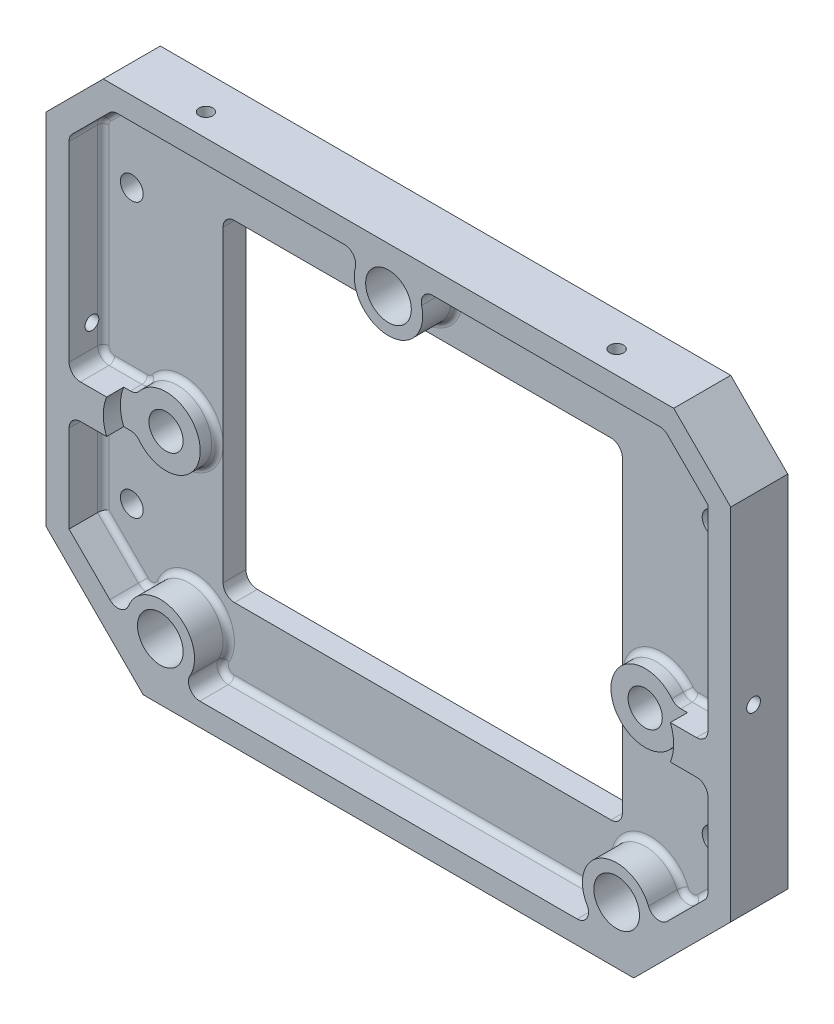
from build123d import *

# Parameters (mm, degrees)
SKETCH_1_R                = 2
SKETCH_1_R_2              = 1.5
EXTRUDE_1_DEPTH           = 2
BOSS_EXTRUDE1_OUTLINE_R   = 2
BOSS_EXTRUDE1_OUTLINE_R_2 = 1.5
BOSS_EXTRUDE1_DEPTH       = 3
FILLET2_R                 = 1
FILLET3_R                 = 0.5
SKETCH4_R                 = 4
CUT_EXTRUDE3_DEPTH        = 1.5
SKETCH5_R                 = 0.6
CUT_EXTRUDE4_DEPTH        = 2.5
SKETCH3_R                 = 1
CUT_EXTRUDE5_DEPTH        = 10
SKETCH6_R                 = 0.6
CUT_EXTRUDE6_DEPTH        = 65


# Read off the part's stored shape, not the designer's step: Boss-Extrude1
with BuildPart() as part:
    # 草图1 → 凸台-拉伸1 (new body)
    with BuildSketch(Plane.XY):
        Polygon((-30, 1.5), (-30, -3.5), (-21.5, -12), (-15.5, -12), (15.5, -12), (21.5, -12), (30, -3.5), (30, 1.5), (30, 25), (30, 28), (25, 33), (-25, 33), (-30, 28), (-30, 25), align=None)
        with Locations((20, -7)):
            Circle(SKETCH_1_R, mode=Mode.SUBTRACT)
        with Locations((0, 29)):
            Circle(SKETCH_1_R, mode=Mode.SUBTRACT)
        with Locations(Location((-20, -7, 0), (0, 0, 180))):
            Circle(SKETCH_1_R, mode=Mode.SUBTRACT)
        with Locations((-21, 7.5)):
            Circle(SKETCH_1_R_2, mode=Mode.SUBTRACT)
        with Locations(Location((21, 7.5, 0), (0, 0, 180))):
            Circle(SKETCH_1_R_2, mode=Mode.SUBTRACT)
        with BuildLine():
            Line((-17.5, 24), (-17.5, -3))
            ThreePointArc((-17.5, -3), (-17.207106781, -3.707106781), (-16.5, -4))
            Line((-16.5, -4), (16.5, -4))
            ThreePointArc((16.5, -4), (17.207106781, -3.707106781), (17.5, -3))
            Line((17.5, -3), (17.5, 24))
            ThreePointArc((17.5, 24), (17.207106781, 24.707106781), (16.5, 25))
            Line((16.5, 25), (-16.5, 25))
            ThreePointArc((-16.5, 25), (-17.207106781, 24.707106781), (-17.5, 24))
        make_face(mode=Mode.SUBTRACT)
    extrude(amount=EXTRUDE_1_DEPTH)

    # Boss-Extrude1 outline → Boss-Extrude1 (add)
    with BuildSketch(Plane.XY.offset(2)):
        Polygon((-21.5, -12), (21.5, -12), (30, -3.5), (30, 28), (25, 33), (-25, 33), (-30, 28), (-30, -3.5), align=None)
        with Locations((-20, -7)):
            Circle(BOSS_EXTRUDE1_OUTLINE_R, mode=Mode.SUBTRACT)
        with Locations((-21, 7.5)):
            Circle(BOSS_EXTRUDE1_OUTLINE_R_2, mode=Mode.SUBTRACT)
        with Locations((20, -7)):
            Circle(BOSS_EXTRUDE1_OUTLINE_R, mode=Mode.SUBTRACT)
        with Locations((21, 7.5)):
            Circle(BOSS_EXTRUDE1_OUTLINE_R_2, mode=Mode.SUBTRACT)
        with BuildLine():
            Line((28, 6), (28, -2.671572875))
            Line((28, -2.671572875), (24.429255588, -6.242317287))
            ThreePointArc((24.429255588, -6.242317287), (23.518347202, -6.514222715), (22.791611605, -5.90140788))
            ThreePointArc((22.791611605, -5.90140788), (18.697105438, -4.297692512), (17.401923789, -8.5))
            ThreePointArc((17.401923789, -8.5), (17.401923789, -9.5), (16.535898385, -10))
            Line((16.535898385, -10), (-16.535898385, -10))
            ThreePointArc((-16.535898385, -10), (-17.401923789, -9.5), (-17.401923789, -8.5))
            ThreePointArc((-17.401923789, -8.5), (-18.697105438, -4.297692512), (-22.791611605, -5.90140788))
            ThreePointArc((-22.791611605, -5.90140788), (-23.518347202, -6.514222715), (-24.429255588, -6.242317287))
            Line((-24.429255588, -6.242317287), (-28, -2.671572875))
            Line((-28, -2.671572875), (-28, 6))
            Line((-28, 6), (-23.598076211, 6))
            ThreePointArc((-23.598076211, 6), (-18, 7.5), (-23.598076211, 9))
            Line((-23.598076211, 9), (-28, 9))
            Line((-28, 9), (-28, 27.171572875))
            Line((-28, 27.171572875), (-24.171572875, 31))
            Line((-24.171572875, 31), (-3.872983346, 31))
            ThreePointArc((-3.872983346, 31), (-3.082413931, 30.612372436), (-2.90473751, 29.75))
            ThreePointArc((-2.90473751, 29.75), (0, 26), (2.90473751, 29.75))
            ThreePointArc((2.90473751, 29.75), (3.082413931, 30.612372436), (3.872983346, 31))
            Line((3.872983346, 31), (24.171572875, 31))
            Line((24.171572875, 31), (28, 27.171572875))
            Line((28, 27.171572875), (28, 9))
            Line((28, 9), (23.598076211, 9))
            ThreePointArc((23.598076211, 9), (18, 7.5), (23.598076211, 6))
            Line((23.598076211, 6), (28, 6))
        make_face(mode=Mode.SUBTRACT)
        with Locations((0, 29)):
            Circle(BOSS_EXTRUDE1_OUTLINE_R, mode=Mode.SUBTRACT)
    extrude(amount=BOSS_EXTRUDE1_DEPTH)

    # Fillet2
    fillet2_edges = [part.edges().sort_by_distance(p)[0] for p in [
        (28, -2.671572875, 3.5),
        (-28, 6, 3.5),
        (-23.598076211, 6, 3.5),
        (-23.598076211, 9, 3.5),
        (-28, 9, 3.5),
        (-28, 27.171572875, 3.5),
        (-24.171572875, 31, 3.5),
        (24.171572875, 31, 3.5),
        (28, 9, 3.5),
        (23.598076211, 9, 3.5),
        (23.598076211, 6, 3.5),
        (28, 6, 3.5),
    ]]
    fillet(fillet2_edges, radius=FILLET2_R)

    # Fillet3
    fillet3_edges = [part.edges().sort_by_distance(p)[0] for p in [
        (23.518347202, -6.514222715, 2),
        (18.697105438, -4.297692512, 2),
        (-17.401923789, -9.5, 2),
        (-18.697105438, -4.297692512, 2),
        (0, 26, 2),
        (26.068181185, -4.60339169, 2),
        (26.232233047, 28.939339828, 2),
        (3.082413931, 30.612372436, 2),
        (-3.082413931, 30.612372436, 2),
        (-13.815171329, 31, 2),
        (-26.214627794, -4.456945081, 2),
        (-23.518347202, -6.514222715, 2),
        (0, -10, 2),
        (17.401923789, -9.5, 2),
        (18, 7.5, 2),
        (28, 1.371320344, 2),
        (25.561249499, 6, 2),
        (25.561249499, 9, 2),
        (28, 18.585786437, 2),
        (13.815171329, 31, 2),
        (-26.085786437, 29.085786438, 2),
        (-28, 18.378679656, 2),
        (-25.561249499, 9, 2),
        (-18, 7.5, 2),
        (-25.561249499, 6, 2),
        (-28, 1.164213562, 2),
        (-24.140042745, 30.923879533, 2),
        (-27.923879533, 27.140042745, 2),
        (24.140042745, 30.923879533, 2),
        (27.923879533, -2.640042745, 2),
        (-27.707106781, 9.292893219, 2),
        (-23.689486297, 9.098612181, 2),
        (-23.689486297, 5.901387819, 2),
        (-27.707106781, 5.707106781, 2),
        (23.689486297, 5.901387819, 2),
        (27.707106781, 5.707106781, 2),
        (27.707106781, 9.292893219, 2),
        (23.689486297, 9.098612181, 2),
    ]]
    fillet(fillet3_edges, radius=FILLET3_R - 0.0001)  # a hair under: the kernel refuses the full size

    # Sketch4 → Cut-Extrude3 (cut)
    with BuildSketch(Plane.XY.offset(5)):
        with Locations((-21, 7.5)):
            Circle(SKETCH4_R)
        with Locations((21, 7.5)):
            Circle(SKETCH4_R)
    extrude(amount=-CUT_EXTRUDE3_DEPTH, mode=Mode.SUBTRACT)

    # Sketch5 → Cut-Extrude4 (cut)
    with BuildSketch(Plane(origin=(0, 33, 0), x_dir=(1, 0, 0), z_dir=(0, 1, 0))):
        with Locations(Location((-18, -3, 0), (0, 0, 180))):
            Circle(SKETCH5_R)
        with Locations(Location((18, -3, 0), (0, 0, 123.55730975))):
            Circle(SKETCH5_R)
    extrude(amount=-CUT_EXTRUDE4_DEPTH, mode=Mode.SUBTRACT)

    # Sketch3 → Cut-Extrude5 (cut)
    with BuildSketch(Plane(origin=(0, 0, 0), x_dir=(-1, 0, 0), z_dir=(0, 0, -1))):
        with Locations((-25.5, 23)):
            Circle(SKETCH3_R)
        with Locations((-25.5, -1)):
            Circle(SKETCH3_R)
        with Locations((25.5, -1)):
            Circle(SKETCH3_R)
        with Locations((25.5, 23)):
            Circle(SKETCH3_R)
    extrude(amount=-CUT_EXTRUDE5_DEPTH, mode=Mode.SUBTRACT)

    # Sketch6 → Cut-Extrude6 (cut)
    with BuildSketch(Plane(origin=(30, 0, 0), x_dir=(0, 0, -1), z_dir=(1, 0, 0))):
        with Locations(Location((-3, 12, 0), (0, 0, 90))):
            Circle(SKETCH6_R)
    extrude(amount=-CUT_EXTRUDE6_DEPTH, mode=Mode.SUBTRACT)


solid = part.part
